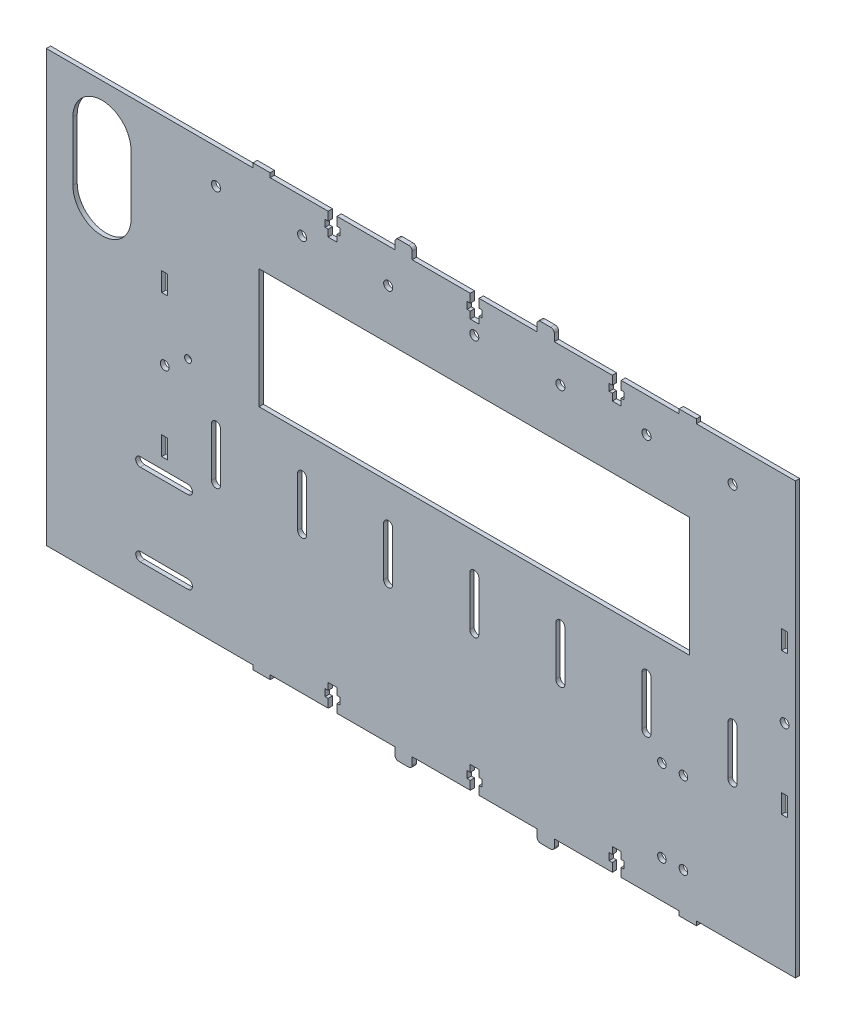
from build123d import *

# Parameters (mm, degrees)
SKETCH_1_W          = 2.8
SKETCH_1_H          = 8.8
SKETCH_1_R          = 2.05
SKETCH_1_R_2        = 2
SKETCH_1_R_3        = 1.596596984
SKETCH_1_R_4        = 2.1
SKETCH_1_W_2        = 200
SKETCH_1_H_2        = 55.5
EXTRUDE_1_DEPTH     = 2
SKETCH_4_W          = 20.705410864
SKETCH_4_H          = 9.065612324
SKETCH_4_W_2        = 41.972556438
SKETCH_4_H_2        = 18.504030257
SKETCH_4_W_3        = 50.856698359
SKETCH_4_H_3        = 15.038626171
SKETCH_4_W_4        = 39.455714808
SKETCH_4_H_4        = 14.320729145
CUT_EXTRUDE_1_DEPTH = 2
FILLET_1_R          = 1.6


with BuildPart() as part:
    # 草图1 → 凸台-拉伸1 (new body)
    with BuildSketch(Plane.XY):
        Polygon((0, -4), (0, 0), (-26.95, 0), (-26.95, 5), (-34.95, 5), (-34.95, 0), (-61.9, 0), (-61.9, -4), (-60.45, -4), (-60.45, -7.2), (-61.9, -7.2), (-61.9, -10.4), (-66, -10.4), (-66, -7.2), (-67.45, -7.2), (-67.45, -4), (-66, -4), (-66, 0), (-92.95, 0), (-92.95, 5), (-100.95, 5), (-100.95, 0), (-127.9, 0), (-139.95, 0), (-141.95, 0), (-146.95, 0), (-196.95, 0), (-196.95, -200), (-146.95, -200), (-141.95, -200), (-139.95, -200), (-127.9, -200), (-100.95, -200), (-100.95, -205), (-92.95, -205), (-92.95, -200), (-66, -200), (-66, -196), (-67.45, -196), (-67.45, -192.8), (-66, -192.8), (-66, -189.6), (-61.9, -189.6), (-61.9, -192.8), (-60.45, -192.8), (-60.45, -196), (-61.9, -196), (-61.9, -200), (-34.95, -200), (-34.95, -205), (-26.95, -205), (-26.95, -200), (0, -200), (0, -196), (-1.45, -196), (-1.45, -192.8), (0, -192.8), (0, -189.6), (4.1, -189.6), (4.1, -192.8), (5.55, -192.8), (5.55, -196), (4.1, -196), (4.1, -200), (31.05, -200), (31.05, -205), (39.05, -205), (39.05, -200), (66, -200), (66, -196), (64.55, -196), (64.55, -192.8), (66, -192.8), (66, -189.6), (70.1, -189.6), (70.1, -192.8), (71.55, -192.8), (71.55, -196), (70.1, -196), (70.1, -200), (97.05, -200), (97.05, -205), (105.05, -205), (105.05, -200), (132, -200), (144.05, -200), (146.05, -200), (151.05, -200), (151.05, 0), (146.05, 0), (144.05, 0), (132, 0), (105.05, 0), (105.05, 5), (97.05, 5), (97.05, 0), (70.1, 0), (70.1, -4), (71.55, -4), (71.55, -7.2), (70.1, -7.2), (70.1, -10.4), (66, -10.4), (66, -7.2), (64.55, -7.2), (64.55, -4), (66, -4), (66, 0), (39.05, 0), (39.05, 5), (31.05, 5), (31.05, 0), (4.1, 0), (4.1, -4), (5.55, -4), (5.55, -7.2), (4.1, -7.2), (4.1, -10.4), (0, -10.4), (0, -7.2), (-1.45, -7.2), (-1.45, -4), align=None)
        with BuildLine():
            ThreePointArc((-153.322396497, -184.727003683), (-155.422396497, -182.627003683), (-153.322396497, -180.527003683))
            Line((-153.322396497, -180.527003683), (-131.177603503, -180.527003683))
            ThreePointArc((-131.177603503, -180.527003683), (-129.077603503, -182.627003683), (-131.177603503, -184.727003683))
            Line((-131.177603503, -184.727003683), (-153.322396497, -184.727003683))
        make_face(mode=Mode.SUBTRACT)
        with BuildLine():
            ThreePointArc((-153.322396497, -146.617403611), (-155.422396497, -144.517403611), (-153.322396497, -142.417403611))
            Line((-153.322396497, -142.417403611), (-131.177603503, -142.417403611))
            ThreePointArc((-131.177603503, -142.417403611), (-129.077603503, -144.517403611), (-131.177603503, -146.617403611))
            Line((-131.177603503, -146.617403611), (-153.322396497, -146.617403611))
        make_face(mode=Mode.SUBTRACT)
        with Locations((-141.95, -133)):
            Rectangle(SKETCH_1_W, SKETCH_1_H, mode=Mode.SUBTRACT)
        with BuildLine():
            ThreePointArc((-116.020950129, -135.421434051), (-118.120950129, -137.521434051), (-120.220950129, -135.421434051))
            Line((-120.220950129, -135.421434051), (-120.220950129, -112.578565949))
            ThreePointArc((-120.220950129, -112.578565949), (-118.120950129, -110.478565949), (-116.020950129, -112.578565949))
            Line((-116.020950129, -112.578565949), (-116.020950129, -135.421434051))
        make_face(mode=Mode.SUBTRACT)
        with Locations((-141.95, -100)):
            Circle(SKETCH_1_R, mode=Mode.SUBTRACT)
        with BuildLine():
            ThreePointArc((-76.020950129, -135.421434051), (-78.120950129, -137.521434051), (-80.220950129, -135.421434051))
            Line((-80.220950129, -135.421434051), (-80.220950129, -112.578565949))
            ThreePointArc((-80.220950129, -112.578565949), (-78.120950129, -110.478565949), (-76.020950129, -112.578565949))
            Line((-76.020950129, -112.578565949), (-76.020950129, -135.421434051))
        make_face(mode=Mode.SUBTRACT)
        with BuildLine():
            ThreePointArc((-36.020950129, -135.421434051), (-38.120950129, -137.521434051), (-40.220950129, -135.421434051))
            Line((-40.220950129, -135.421434051), (-40.220950129, -112.578565949))
            ThreePointArc((-40.220950129, -112.578565949), (-38.120950129, -110.478565949), (-36.020950129, -112.578565949))
            Line((-36.020950129, -112.578565949), (-36.020950129, -135.421434051))
        make_face(mode=Mode.SUBTRACT)
        with Locations((89.050600627, -182.627003683)):
            Circle(SKETCH_1_R_2, mode=Mode.SUBTRACT)
        with Locations((99.05, -182.517403611)):
            Circle(SKETCH_1_R_2, mode=Mode.SUBTRACT)
        with BuildLine():
            ThreePointArc((3.979049871, -135.421434051), (1.879049871, -137.521434051), (-0.220950129, -135.421434051))
            Line((-0.220950129, -135.421434051), (-0.220950129, -112.578565949))
            ThreePointArc((-0.220950129, -112.578565949), (1.879049871, -110.478565949), (3.979049871, -112.578565949))
            Line((3.979049871, -112.578565949), (3.979049871, -135.421434051))
        make_face(mode=Mode.SUBTRACT)
        with BuildLine():
            ThreePointArc((43.979049871, -135.421434051), (41.879049871, -137.521434051), (39.779049871, -135.421434051))
            Line((39.779049871, -135.421434051), (39.779049871, -112.578565949))
            ThreePointArc((39.779049871, -112.578565949), (41.879049871, -110.478565949), (43.979049871, -112.578565949))
            Line((43.979049871, -112.578565949), (43.979049871, -135.421434051))
        make_face(mode=Mode.SUBTRACT)
        with Locations((89.05, -144.517403611)):
            Circle(SKETCH_1_R_2, mode=Mode.SUBTRACT)
        with Locations((99.05, -144.517403611)):
            Circle(SKETCH_1_R_2, mode=Mode.SUBTRACT)
        with Locations((146.05, -133)):
            Rectangle(SKETCH_1_W, SKETCH_1_H, mode=Mode.SUBTRACT)
        with BuildLine():
            ThreePointArc((83.979049871, -135.421434051), (81.879049871, -137.521434051), (79.779049871, -135.421434051))
            Line((79.779049871, -135.421434051), (79.779049871, -112.578565949))
            ThreePointArc((79.779049871, -112.578565949), (81.879049871, -110.478565949), (83.979049871, -112.578565949))
            Line((83.979049871, -112.578565949), (83.979049871, -135.421434051))
        make_face(mode=Mode.SUBTRACT)
        with BuildLine():
            ThreePointArc((123.979049871, -135.421434051), (121.879049871, -137.521434051), (119.779049871, -135.421434051))
            Line((119.779049871, -135.421434051), (119.779049871, -112.578565949))
            ThreePointArc((119.779049871, -112.578565949), (121.879049871, -110.478565949), (123.979049871, -112.578565949))
            Line((123.979049871, -112.578565949), (123.979049871, -135.421434051))
        make_face(mode=Mode.SUBTRACT)
        with Locations((146.05, -100)):
            Circle(SKETCH_1_R, mode=Mode.SUBTRACT)
        with Locations((-131.123167438, -92.012309478)):
            Circle(SKETCH_1_R_3, mode=Mode.SUBTRACT)
        with Locations((-141.95, -67)):
            Rectangle(SKETCH_1_W, SKETCH_1_H, mode=Mode.SUBTRACT)
        with BuildLine():
            ThreePointArc((-184.619440921, -21.411124162), (-171.105830678, -7.897513919), (-157.592220434, -21.411124162))
            Line((-157.592220434, -21.411124162), (-157.592220434, -48.874356868))
            ThreePointArc((-157.592220434, -48.874356868), (-171.105830678, -62.387967111), (-184.619440921, -48.874356868))
            Line((-184.619440921, -48.874356868), (-184.619440921, -21.411124162))
        make_face(mode=Mode.SUBTRACT)
        with Locations((-118.120950129, -16)):
            Circle(SKETCH_1_R_4, mode=Mode.SUBTRACT)
        with Locations((-78.120950129, -16)):
            Circle(SKETCH_1_R_4, mode=Mode.SUBTRACT)
        with Locations((-38.120950129, -16)):
            Circle(SKETCH_1_R_4, mode=Mode.SUBTRACT)
        with Locations((1.879049871, -66.985697847)):
            Rectangle(SKETCH_1_W_2, SKETCH_1_H_2, mode=Mode.SUBTRACT)
        with Locations((146.05, -67)):
            Rectangle(SKETCH_1_W, SKETCH_1_H, mode=Mode.SUBTRACT)
        with Locations((1.879049871, -16)):
            Circle(SKETCH_1_R_4, mode=Mode.SUBTRACT)
        with Locations((41.879049871, -16)):
            Circle(SKETCH_1_R_4, mode=Mode.SUBTRACT)
        with Locations((81.879049871, -16)):
            Circle(SKETCH_1_R_4, mode=Mode.SUBTRACT)
        with Locations((121.879049871, -16)):
            Circle(SKETCH_1_R_4, mode=Mode.SUBTRACT)
    extrude(amount=EXTRUDE_1_DEPTH)

    # 草图4 → 切除-拉伸1 (cut)
    with BuildSketch(Plane.XY.offset(2)):
        with Locations((100.492114265, 6.532806162)):
            Rectangle(SKETCH_4_W, SKETCH_4_H)
        with Locations((108.073065758, -211.252015129)):
            Rectangle(SKETCH_4_W_2, SKETCH_4_H_2)
        with Locations((-100.387548901, -209.519313086)):
            Rectangle(SKETCH_4_W_3, SKETCH_4_H_3)
        with Locations((-106.088040676, 9.160364573)):
            Rectangle(SKETCH_4_W_4, SKETCH_4_H_4)
    extrude(amount=-CUT_EXTRUDE_1_DEPTH, mode=Mode.SUBTRACT)

    # 圆角1
    fillet_1_edges = [part.edges().sort_by_distance(p)[0] for p in [
        (39.05, 5, 1),
        (31.05, 5, 1),
        (-26.95, 5, 1),
        (-34.95, 5, 1),
        (39.05, -205, 1),
        (31.05, -205, 1),
        (-26.95, -205, 1),
        (-34.95, -205, 1),
    ]]
    fillet(fillet_1_edges, radius=FILLET_1_R)


solid = part.part
